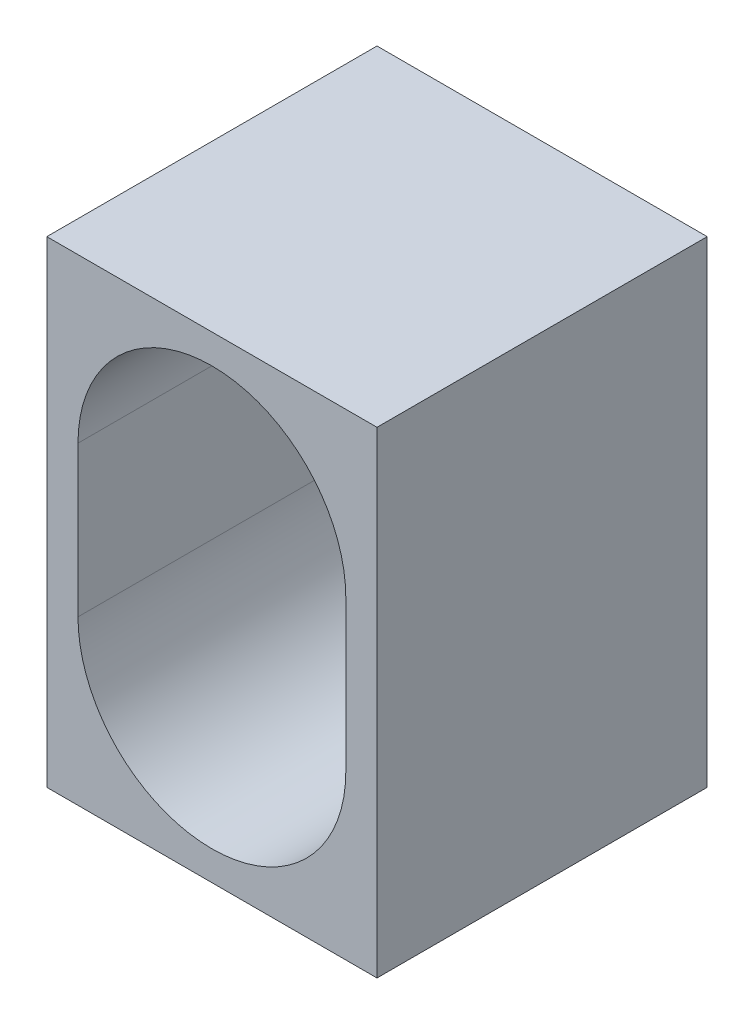
from build123d import *

# Parameters (mm, degrees)
SKETCH4_W           = 45
SKETCH4_H           = 65
BOSS_EXTRUDE2_DEPTH = 45
CUT_EXTRUDE1_DEPTH  = 42.5


with BuildPart() as part:
    # Sketch4 → Boss-Extrude2 (new body)
    with BuildSketch(Plane.XY):
        with Locations((-7.784904398, -11.939291809)):
            Rectangle(SKETCH4_W, SKETCH4_H)
    extrude(amount=BOSS_EXTRUDE2_DEPTH)

    # Sketch5 → Cut-Extrude1 (cut)
    with BuildSketch(Plane.XY.offset(45)):
        with BuildLine():
            Line((-26.034904398, -22.189291809), (-26.034904398, -1.689291809))
            ThreePointArc((-26.034904398, -1.689291809), (-7.784904398, 16.560708191), (10.465095602, -1.689291809))
            Line((10.465095602, -1.689291809), (10.465095602, -22.189291809))
            ThreePointArc((10.465095602, -22.189291809), (-7.784904398, -40.439291809), (-26.034904398, -22.189291809))
        make_face()
    extrude(amount=-CUT_EXTRUDE1_DEPTH, mode=Mode.SUBTRACT)


solid = part.part
